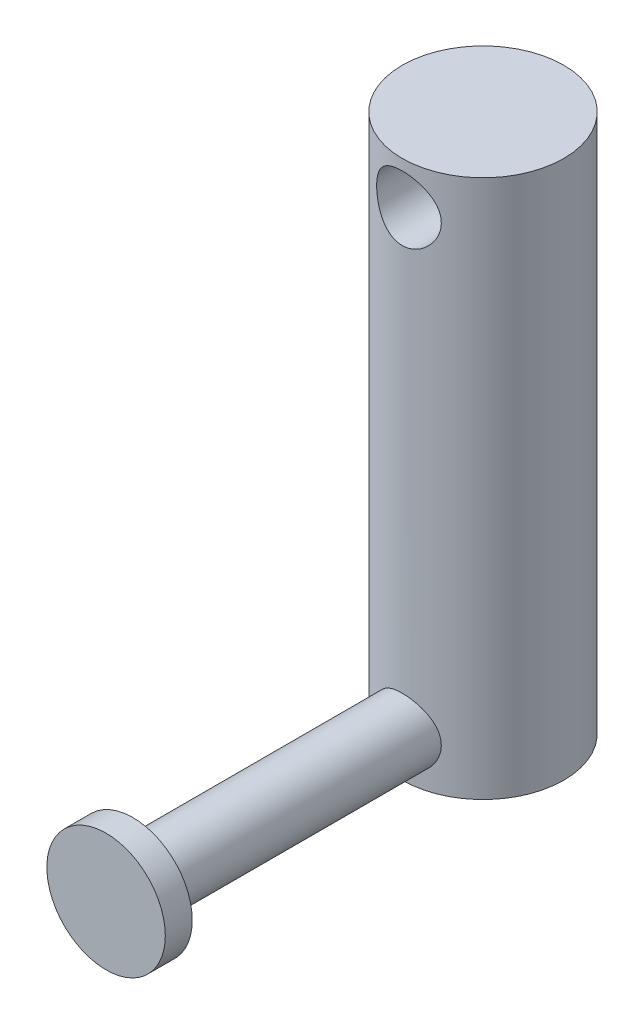
from build123d import *

# Parameters (mm, degrees)
SKETCH1_R                            = 15
BOSS_EXTRUDE1_DEPTH                  = 100
SKETCH2_R                            = 6
BOSS_EXTRUDE2_DEPTH                  = 50
BOSS_EXTRUDE2_DIRECTION_2_REACH      = 107.475
BOSS_EXTRUDE2_DIRECTION_2_END_RADIUS = 15
CUT_EXTRUDE1_DEPTH                   = 121.208152856
CUT_EXTRUDE1_DEPTH_BACK              = 121.208152856
SKETCH3_R                            = 6
SKETCH4_R                            = 11
BOSS_EXTRUDE3_DEPTH                  = 5


with BuildPart() as part:
    # Sketch1 → Boss-Extrude1 (new body)
    with BuildSketch(Plane(origin=(0, 0, 0), x_dir=(1, 0, 0), z_dir=(0, 1, 0))):
        Circle(SKETCH1_R)
    extrude(amount=BOSS_EXTRUDE1_DEPTH)

    # Sketch3 → Cut-Extrude1 (cut, two sides: drawn at the far end of the back side and taken through both)
    with BuildSketch(Plane.XY.offset(-CUT_EXTRUDE1_DEPTH_BACK)):
        with Locations((0, 92)):
            Circle(SKETCH3_R)
    extrude(amount=CUT_EXTRUDE1_DEPTH + CUT_EXTRUDE1_DEPTH_BACK, mode=Mode.SUBTRACT)


with BuildPart() as body_2:
    # Sketch2 → Boss-Extrude2 (new body)
    with BuildSketch(Plane.XY.offset(15)):
        with Locations((0, 8)):
            Circle(SKETCH2_R)
    extrude(amount=BOSS_EXTRUDE2_DEPTH)

    # Boss-Extrude2 direction 2: up to this cylinder (the profile starts outside it)
    boss_extrude2_direction_2_end = Plane(origin=(0, 8, 0), z_dir=(0, -1, 0)) * Cylinder(BOSS_EXTRUDE2_DIRECTION_2_END_RADIUS, 245.95, mode=Mode.PRIVATE)
    # Sketch2 → Boss-Extrude2 direction 2 (add, up to the surface)
    with BuildSketch(Plane.XY.offset(15), mode=Mode.PRIVATE) as boss_extrude2_direction_2_sk1:
        with Locations((0, 8)):
            Circle(SKETCH2_R)
    boss_extrude2_direction_2_tool1 = extrude(boss_extrude2_direction_2_sk1.sketch, amount=-BOSS_EXTRUDE2_DIRECTION_2_REACH, mode=Mode.PRIVATE) - boss_extrude2_direction_2_end
    add(boss_extrude2_direction_2_tool1.solids().sort_by_distance((0, 8, 15))[0])
    add(boss_extrude2_direction_2_tool1.solids().sort_by_distance((0, 8, 15))[1])

    # Sketch4 → Boss-Extrude3 (add)
    with BuildSketch(Plane.XY.offset(65)):
        with Locations((0, 8)):
            Circle(SKETCH4_R)
    extrude(amount=BOSS_EXTRUDE3_DEPTH)


solid = Compound([part.part, body_2.part])
